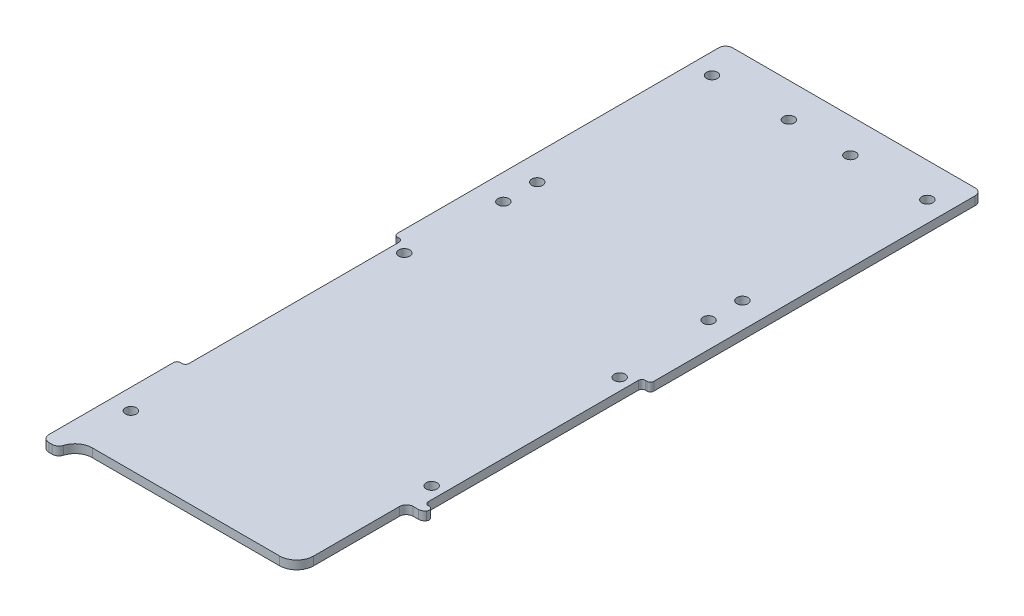
from build123d import *

# Parameters (mm, degrees)
SKETCH1_R               = 2.032
BOSS_EXTRUDE1_DEPTH     = 3.175
FILLET1_R               = 2.54
FILLET2_R               = 2.54
FILLET3_R               = 6.35
CUT_EXTRUDE1_DEPTH      = 136.673215063
FILLET4_R               = 6.35
FILLET5_R               = 2.54
SKETCH3_R               = 2.032
CUT_EXTRUDE2_DEPTH      = 136.673215063
CUT_EXTRUDE3_DEPTH      = 136.673215063
CUT_EXTRUDE3_DEPTH_BACK = 136.673215063
SKETCH4_W               = 3.175
SKETCH4_H               = 80.645
FILLET6_R               = 1.27


with BuildPart() as part:
    # Sketch1 → Boss-Extrude1 (new body)
    with BuildSketch(Plane(origin=(0, 0, 0), x_dir=(1, 0, 0), z_dir=(0, 1, 0))):
        Polygon((47.625, 127), (-47.625, 127), (-47.625, -127), (-41.275, -127), (-41.275, -120.65), (41.275, -120.65), (41.275, -127), (47.625, -127), align=None)
        with Locations((-39.999684148, -101.6)):
            Circle(SKETCH1_R, mode=Mode.SUBTRACT)
        with Locations((39.999684148, -69.85)):
            Circle(SKETCH1_R, mode=Mode.SUBTRACT)
        with Locations((-39.999684148, 0)):
            Circle(SKETCH1_R, mode=Mode.SUBTRACT)
        with Locations((-39.999684148, 114.3)):
            Circle(SKETCH1_R, mode=Mode.SUBTRACT)
        with Locations((-11.424684148, 114.3)):
            Circle(SKETCH1_R, mode=Mode.SUBTRACT)
        with Locations((39.999684148, 0)):
            Circle(SKETCH1_R, mode=Mode.SUBTRACT)
        with Locations((11.424684148, 114.3)):
            Circle(SKETCH1_R, mode=Mode.SUBTRACT)
        with Locations((39.999684148, 114.3)):
            Circle(SKETCH1_R, mode=Mode.SUBTRACT)
    extrude(amount=BOSS_EXTRUDE1_DEPTH)

    # Fillet1
    fillet1_edges = [part.edges().sort_by_distance(p)[0] for p in [
        (-47.625, 1.5875, -127),
        (47.625, 1.5875, -127),
        (47.625, 1.5875, 127),
        (-47.625, 1.5875, 127),
    ]]
    fillet(fillet1_edges, radius=FILLET1_R)

    # Fillet2
    fillet2_edges = [part.edges().sort_by_distance(p)[0] for p in [
        (41.275, 1.5875, 127),
        (-41.275, 1.5875, 127),
    ]]
    fillet(fillet2_edges, radius=FILLET2_R)

    # Fillet3
    fillet3_edges = [part.edges().sort_by_distance(p)[0] for p in [
        (41.275, 1.5875, 120.65),
        (-41.275, 1.5875, 120.65),
    ]]
    fillet(fillet3_edges, radius=FILLET3_R)

    # Sketch2 → Cut-Extrude1 (cut, through all)
    with BuildSketch(Plane.XZ):
        with BuildLine():
            Line((40.64508, 123.578690235), (40.64508, 79.88808))
            Line((40.64508, 79.88808), (47.625, 79.88808))
            Line((47.625, 79.88808), (47.625, 124.46))
            ThreePointArc((47.625, 124.46), (46.881051224, 126.256051224), (45.085, 127))
            Line((45.085, 127), (43.815, 127))
            ThreePointArc((43.815, 127), (42.297059666, 126.496530663), (41.380880287, 125.185714286))
            ThreePointArc((41.380880287, 125.185714286), (41.069166069, 124.356476684), (40.64508, 123.578690235))
        make_face()
    extrude(amount=-CUT_EXTRUDE1_DEPTH, mode=Mode.SUBTRACT)

    # Fillet4
    fillet4_edges = [part.edges().sort_by_distance(p)[0] for p in [
        (40.64508, 1.5875, 123.578690235),
    ]]
    fillet(fillet4_edges, radius=FILLET4_R)

    # Fillet5
    fillet5_edges = [part.edges().sort_by_distance(p)[0] for p in [
        (47.625, 1.5875, 79.88808),
        (40.64508, 1.5875, 79.88808),
    ]]
    fillet(fillet5_edges, radius=FILLET5_R)

    # Sketch3 → Cut-Extrude2 (cut, through all)
    with BuildSketch(Plane.XZ):
        with Locations((-38.109733823, -34.913768806)):
            Circle(SKETCH3_R)
        with Locations((-38.109733823, -47.490173279)):
            Circle(SKETCH3_R)
        with Locations((38.109733823, -47.490173279)):
            Circle(SKETCH3_R)
        with Locations((38.109733823, -34.913768806)):
            Circle(SKETCH3_R)
    extrude(amount=-CUT_EXTRUDE2_DEPTH, mode=Mode.SUBTRACT)

    # Sketch4 → Cut-Extrude3 (cut, two sides: drawn at the far end of the back side and taken through both)
    with BuildSketch(Plane(origin=(0, 3.175, 0), x_dir=(1, 0, 0), z_dir=(0, 1, 0)).offset(-CUT_EXTRUDE3_DEPTH_BACK)):
        with Locations((-46.0375, -36.5125)):
            Rectangle(SKETCH4_W, SKETCH4_H)
        with Locations((46.0375, -36.5125)):
            Rectangle(SKETCH4_W, SKETCH4_H)
    extrude(amount=CUT_EXTRUDE3_DEPTH + CUT_EXTRUDE3_DEPTH_BACK, mode=Mode.SUBTRACT)

    # Fillet6
    fillet6_edges = [part.edges().sort_by_distance(p)[0] for p in [
        (-44.45, 1.5875, -3.81),
        (-47.625, 1.5875, -3.81),
        (-47.625, 1.5875, 76.835),
        (-44.45, 1.5875, 76.835),
        (44.45, 1.5875, 76.835),
        (47.625, 1.5875, 76.835),
        (44.45, 1.5875, -3.81),
        (47.625, 1.5875, -3.81),
    ]]
    fillet(fillet6_edges, radius=FILLET6_R)


solid = part.part
